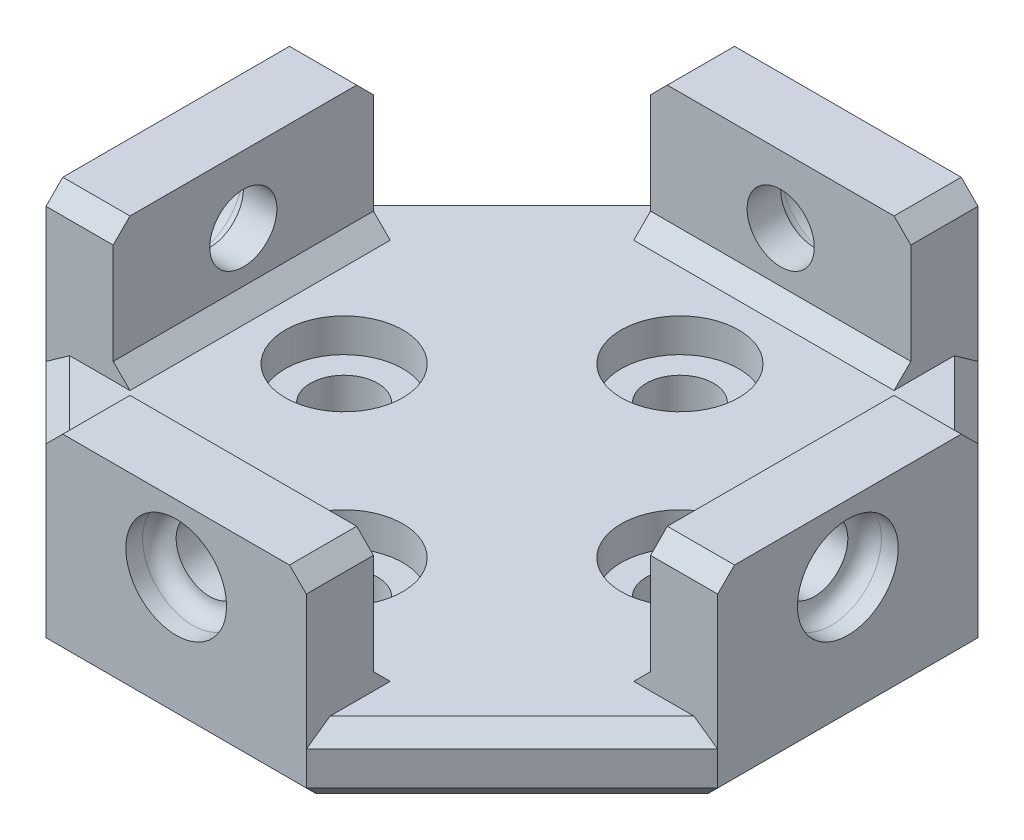
from build123d import *

# Parameters (mm, degrees)
SKETCH1_W               = 40
SKETCH1_H               = 40
BOSS_EXTRUDE1_DEPTH     = 4
SKETCH2_R               = 2
CUT_EXTRUDE1_DEPTH      = 29.565713714
CUT_EXTRUDE2_DEPTH      = 29.565713714
SKETCH4_W               = 15.5
SKETCH4_H               = 4
SKETCH4_W_2             = 4
SKETCH4_H_2             = 15.5
BOSS_EXTRUDE2_DEPTH     = 8
CUT_EXTRUDE3_DEPTH      = 43.895221179
CUT_EXTRUDE3_DEPTH_BACK = 5
SKETCH5_R               = 2
CUT_EXTRUDE4_DEPTH      = 43.895221179
CUT_EXTRUDE4_DEPTH_BACK = 5
SKETCH6_R               = 2
SKETCH7_R               = 3
CUT_EXTRUDE5_DEPTH      = 2
CIRPATTERN1_COUNT       = 4
CHAMFER1_SIZE           = 1
FILLET1_R               = 1
CHAMFER2_SIZE           = 1
SKETCH10_R              = 3.5
CUT_EXTRUDE6_DEPTH      = 2


with BuildPart() as part:
    # Sketch1 → Boss-Extrude1 (new body)
    with BuildSketch(Plane(origin=(0, 0, 0), x_dir=(1, 0, 0), z_dir=(0, 1, 0))):
        Rectangle(SKETCH1_W, SKETCH1_H)
    extrude(amount=BOSS_EXTRUDE1_DEPTH)

    # Sketch2 → Cut-Extrude1 (cut, through all)
    with BuildSketch(Plane(origin=(0, 4, 0), x_dir=(1, 0, 0), z_dir=(0, 1, 0))):
        with Locations(Location((-10, 0, 0), (0, 0, 270))):
            Circle(SKETCH2_R)
        with Locations(Location((0, 10, 0), (0, 0, 270))):
            Circle(SKETCH2_R)
        with Locations(Location((10, 0, 0), (0, 0, 270))):
            Circle(SKETCH2_R)
        with Locations(Location((0, -10, 0), (0, 0, 270))):
            Circle(SKETCH2_R)
    extrude(amount=-CUT_EXTRUDE1_DEPTH, mode=Mode.SUBTRACT)

    # Sketch3 → Cut-Extrude2 (cut, through all)
    with BuildSketch(Plane(origin=(0, 4, 0), x_dir=(1, 0, 0), z_dir=(0, 1, 0))):
        Polygon((-7.75, 20), (-20, 20), (-20, 7.75), align=None)
        Polygon((20, 7.75), (20, 20), (7.75, 20), align=None)
        Polygon((20, -7.75), (7.75, -20), (20, -20), align=None)
        Polygon((-20, -7.75), (-7.75, -20), (-20, -20), align=None)
    extrude(amount=-CUT_EXTRUDE2_DEPTH, mode=Mode.SUBTRACT)

    # Sketch4 → Boss-Extrude2 (add)
    with BuildSketch(Plane(origin=(0, 4, 0), x_dir=(1, 0, 0), z_dir=(0, 1, 0))):
        with Locations((0, 18)):
            Rectangle(SKETCH4_W, SKETCH4_H)
        with Locations((18, 0)):
            Rectangle(SKETCH4_W_2, SKETCH4_H_2)
        with Locations((0, -18)):
            Rectangle(SKETCH4_W, SKETCH4_H)
        with Locations((-18, 0)):
            Rectangle(SKETCH4_W_2, SKETCH4_H_2)
    extrude(amount=BOSS_EXTRUDE2_DEPTH)

    # Sketch5 → Cut-Extrude3 (cut, two sides: drawn at the far end of the back side and taken through both)
    with BuildSketch(Plane.ZY.offset(-16).offset(-CUT_EXTRUDE3_DEPTH_BACK)):
        with Locations((0, 8)):
            Circle(SKETCH5_R)
    extrude(amount=CUT_EXTRUDE3_DEPTH + CUT_EXTRUDE3_DEPTH_BACK, mode=Mode.SUBTRACT)

    # Sketch6 → Cut-Extrude4 (cut, two sides: drawn at the far end of the back side and taken through both)
    with BuildSketch(Plane(origin=(0, 0, 16), x_dir=(-1, 0, 0), z_dir=(0, 0, -1)).offset(-CUT_EXTRUDE4_DEPTH_BACK)):
        with Locations(Location((0, 8, 0), (0, 0, 180))):
            Circle(SKETCH6_R)
    extrude(amount=CUT_EXTRUDE4_DEPTH + CUT_EXTRUDE4_DEPTH_BACK, mode=Mode.SUBTRACT)

    # Sketch7 → Cut-Extrude5 (cut)
    with BuildSketch(Plane.XY.offset(20)):
        with Locations((0, 8)):
            Circle(SKETCH7_R)
    cut_extrude5 = extrude(amount=-CUT_EXTRUDE5_DEPTH, mode=Mode.SUBTRACT)

    # CirPattern1: Cut-Extrude5 ×4 about axis
    cirpattern1_axis = Axis((0, 0, 0), (0, 1, 0))
    for i in range(1, CIRPATTERN1_COUNT):
        add(cut_extrude5.rotate(cirpattern1_axis, i * 360 / CIRPATTERN1_COUNT), mode=Mode.SUBTRACT)

    # Chamfer1
    chamfer1_edges = [part.edges().sort_by_distance(p)[0] for p in [
        (7.75, 12, 18),
        (-7.75, 12, 18),
        (-18, 12, 7.75),
        (-18, 12, -7.75),
        (20, 0, 0),
        (0, 0, 20),
        (-20, 0, 0),
        (0, 0, -20),
        (-13.875, 0, 13.875),
        (13.875, 0, 13.875),
        (13.875, 0, -13.875),
        (-13.875, 0, -13.875),
        (7.75, 12, -18),
        (-7.75, 12, -18),
        (18, 12, -7.75),
        (18, 12, 7.75),
    ]]
    chamfer(chamfer1_edges, length=CHAMFER1_SIZE)

    # Fillet1
    fillet1_edges = [part.edges().sort_by_distance(p)[0] for p in [
        (-3, 8, 18),
        (-18, 8, -3),
        (3, 8, -18),
        (18, 8, 3),
    ]]
    fillet(fillet1_edges, radius=FILLET1_R - 0.0001)  # a hair under: the kernel refuses the full size

    # Chamfer2
    chamfer2_edges = [part.edges().sort_by_distance(p)[0] for p in [
        (0, 4, 16),
        (-16, 4, 0),
        (-13.875, 4, 13.875),
        (13.875, 4, 13.875),
        (13.875, 4, -13.875),
        (-13.875, 4, -13.875),
        (0, 4, -16),
        (16, 4, 0),
    ]]
    chamfer(chamfer2_edges, length=CHAMFER2_SIZE)

    # Sketch10 → Cut-Extrude6 (cut)
    with BuildSketch(Plane(origin=(0, 4, 0), x_dir=(1, 0, 0), z_dir=(0, 1, 0))):
        with Locations(Location((-10, 0, 0), (0, 0, 270))):
            Circle(SKETCH10_R)
        with Locations(Location((0, 10, 0), (0, 0, 270))):
            Circle(SKETCH10_R)
        with Locations(Location((10, 0, 0), (0, 0, 270))):
            Circle(SKETCH10_R)
        with Locations(Location((0, -10, 0), (0, 0, 270))):
            Circle(SKETCH10_R)
    extrude(amount=-CUT_EXTRUDE6_DEPTH, mode=Mode.SUBTRACT)


solid = part.part
